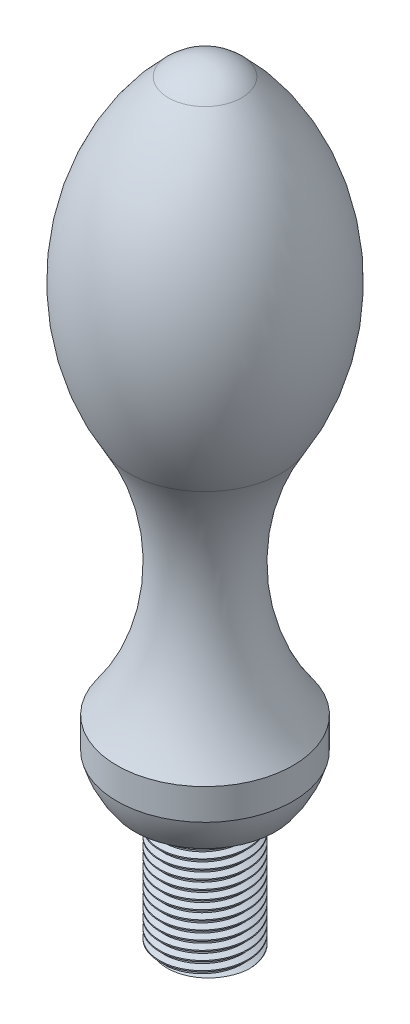
from build123d import *

# Parameters (mm, degrees)
THREAD1_PITCH = 1
THREAD1_TO    = 20


with BuildPart() as part:
    # Sketch1 → Revolve1 (revolve)
    with BuildSketch(Plane.XY, mode=Mode.PRIVATE) as revolve1_sk:
        with BuildLine():
            Line((5, 0), (5, 15))
            Line((5, 15), (8, 15))
            ThreePointArc((8, 15), (9.205423438, 16.897288281), (10, 19))
            Line((10, 19), (10, 22.516872973))
            ThreePointArc((10, 22.516872973), (5, 36.337188282), (8.629762931, 50.578885383))
            ThreePointArc((8.629762931, 50.578885383), (12.5, 68.733206374), (4.164977046, 85.318907987))
            ThreePointArc((4.164977046, 85.318907987), (2.245723945, 86.563876703), (0, 87))
            Line((0, 87), (0, 0))
            Line((0, 0), (5, 0))
        make_face()
    revolve(revolve1_sk.sketch.rotate(Axis((0, 0, 0), (0, 1, 0)), 90), axis=Axis((0, 0, 0), (0, 1, 0)))

    # Thread1: arcs per turn and ends read off the stored shape
    # Thread1: the profile of Thread Profile1 profile screwed along a right-hand helix through 20 turns, 8 arcs to a turn; built about Z, then put on its axis
    thread1_z = Axis((0, 0, 0), (0, 0, 1))
    thread1_corners = [(5.0003, 0, -0.000173205), (5.0003, 0, 0.875173202), (4.458734125, 0, 0.562499999), (4.458734125, 0, 0.312499999)]
    with BuildLine(mode=Mode.PRIVATE) as thread1_profile:
        Line(thread1_corners[0], thread1_corners[1])
        Line(thread1_corners[1], thread1_corners[2])
        Line(thread1_corners[2], thread1_corners[3])
        Line(thread1_corners[3], thread1_corners[0])
    thread1_cap = Face(thread1_profile.wire())
    thread1_turn_angles = [0, 22.5, 45, 67.5, 90, 112.5, 135, 157.5, 180, 202.5, 225, 247.5, 270, 292.5, 315, 337.5, 360]
    thread1_turn_weights = [1, 0.9238795325112867, 1, 0.9238795325112867, 1, 0.9238795325112867, 1, 0.9238795325112867, 1, 0.9238795325112867, 1, 0.9238795325112867, 1, 0.9238795325112867, 1, 0.9238795325112867, 1]
    thread1_turn_rails = [Edge.make_bspline([Vector(p[0], p[1], 0).rotate(thread1_z, thread1_turn_angles[k]) / thread1_turn_weights[k] + Vector(0, 0, p[2] + THREAD1_PITCH * thread1_turn_angles[k] / 360) for k in range(17)], [0, 0, 0, 1, 1, 2, 2, 3, 3, 4, 4, 5, 5, 6, 6, 7, 7, 8, 8, 8], 2, thread1_turn_weights) for p in thread1_corners]
    thread1_turn_sides = [Face.make_surface_from_curves(thread1_turn_rails[p[0]], thread1_turn_rails[p[1]]) for p in [(0, 1), (1, 2), (2, 3), (3, 0)]]
    thread1 = Plane(origin=(0, -5, 0), x_dir=(1, 0, 0), z_dir=(0, 1, 0)) * split(Solid(Shell([*[p.moved(Location((0, 0, THREAD1_PITCH * i))) for i in range(20) for p in thread1_turn_sides], thread1_cap, thread1_cap.rotate(thread1_z, 7200).moved(Location((0, 0, THREAD1_PITCH * 7200 / 360)))])), bisect_by=Plane.XY.offset(THREAD1_TO), keep=Keep.BOTTOM, mode=Mode.PRIVATE)
    add(thread1, mode=Mode.SUBTRACT)


solid = part.part
